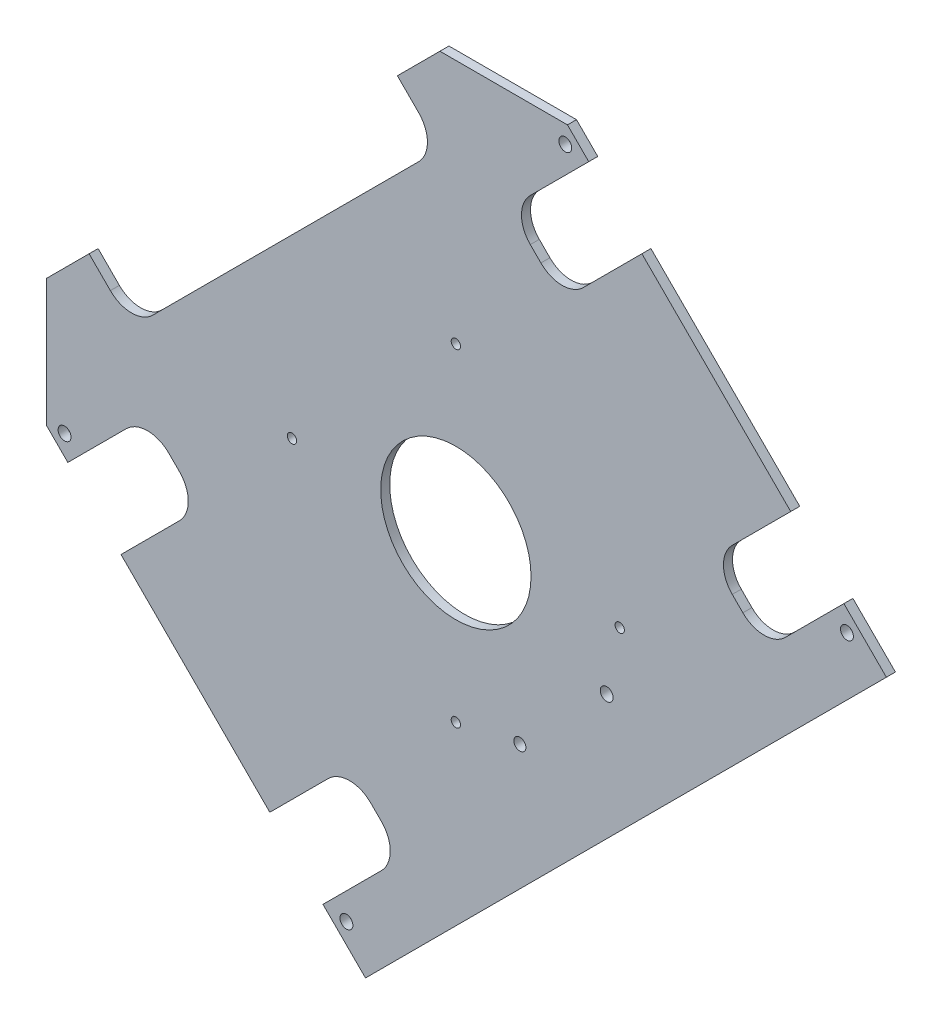
from build123d import *

# Parameters (mm, degrees)
SKETCH1_R          = 25
SKETCH1_R_2        = 2.15
SKETCH1_R_3        = 1.55
SKETCH1_R_4        = 2
EXTRUDE1_DEPTH     = 3
FILLET1_R          = 10
FILLET2_R          = 10
CHAMFER1_SIZE      = 30
SKETCH3_R          = 2.15
CUT_EXTRUDE1_DEPTH = 3


with BuildPart() as part:
    # Sketch1 → Extrude1 (new body)
    with BuildSketch(Plane.XY):
        Polygon((17.677615256, 102.530428998), (44.19411955, 129.046933293), (15.909848303, 157.33120454), (-19.445490757, 121.975865481), (-5.303355133, 107.833729857), (-107.833729857, 5.303355133), (-121.975865481, 19.445490757), (-157.33120454, -15.909848303), (-129.046933293, -44.19411955), (-102.530428998, -17.677615256), (-84.852759469, -35.355284785), (-111.369263763, -61.87178908), (-61.87178908, -111.369263763), (-35.355284785, -84.852759469), (-17.677615256, -102.530428998), (-44.19411955, -129.046933293), (-30.051983927, -143.189068916), (143.189068916, 30.051983927), (129.046933293, 44.19411955), (102.530428998, 17.677615256), (84.852759468, 35.355284785), (111.369263763, 61.87178908), (61.87178908, 111.369263763), (35.355284785, 84.852759468), align=None)
        Circle(SKETCH1_R, mode=Mode.SUBTRACT)
        with Locations((50.167514513, -21.294846503)):
            Circle(SKETCH1_R_2, mode=Mode.SUBTRACT)
        with Locations((54.5, 0)):
            Circle(SKETCH1_R_3, mode=Mode.SUBTRACT)
        with Locations((0, 54.5)):
            Circle(SKETCH1_R_3, mode=Mode.SUBTRACT)
        with Locations((0, -54.5)):
            Circle(SKETCH1_R_3, mode=Mode.SUBTRACT)
        with Locations((21.294846503, -50.167514513)):
            Circle(SKETCH1_R_4, mode=Mode.SUBTRACT)
        with Locations((-54.5, 0)):
            Circle(SKETCH1_R_3, mode=Mode.SUBTRACT)
    extrude(amount=EXTRUDE1_DEPTH)

    # Fillet1
    fillet1_edges = [part.edges().sort_by_distance(p)[0] for p in [
        (-5.303355133, 107.833729857, 1.5),
        (-107.833729857, 5.303355133, 1.5),
    ]]
    fillet(fillet1_edges, radius=FILLET1_R)

    # Fillet2
    fillet2_edges = [part.edges().sort_by_distance(p)[0] for p in [
        (35.355284785, 84.852759468, 1.5),
        (17.677615256, 102.530428998, 1.5),
        (84.852759468, 35.355284785, 1.5),
        (102.530428998, 17.677615256, 1.5),
        (-17.677615256, -102.530428998, 1.5),
        (-35.355284785, -84.852759469, 1.5),
        (-84.852759469, -35.355284785, 1.5),
        (-102.530428998, -17.677615256, 1.5),
    ]]
    fillet(fillet2_edges, radius=FILLET2_R)

    # Chamfer1
    chamfer1_edges = [part.edges().sort_by_distance(p)[0] for p in [
        (-157.33120454, -15.909848303, 1.5),
        (15.909848303, 157.33120454, 1.5),
    ]]
    chamfer(chamfer1_edges, length=CHAMFER1_SIZE)

    # Sketch3 → Cut-Extrude1 (cut)
    with BuildSketch(Plane.XY.offset(3)):
        with Locations((130.064043572, 36.323458724)):
            Circle(SKETCH3_R)
        with Locations((36.394169402, 130.13475425)):
            Circle(SKETCH3_R)
        with Locations((-36.3941694, -130.134754248)):
            Circle(SKETCH3_R)
        with Locations((-130.13475425, -36.394169402)):
            Circle(SKETCH3_R)
    extrude(amount=-CUT_EXTRUDE1_DEPTH, mode=Mode.SUBTRACT)


solid = part.part
